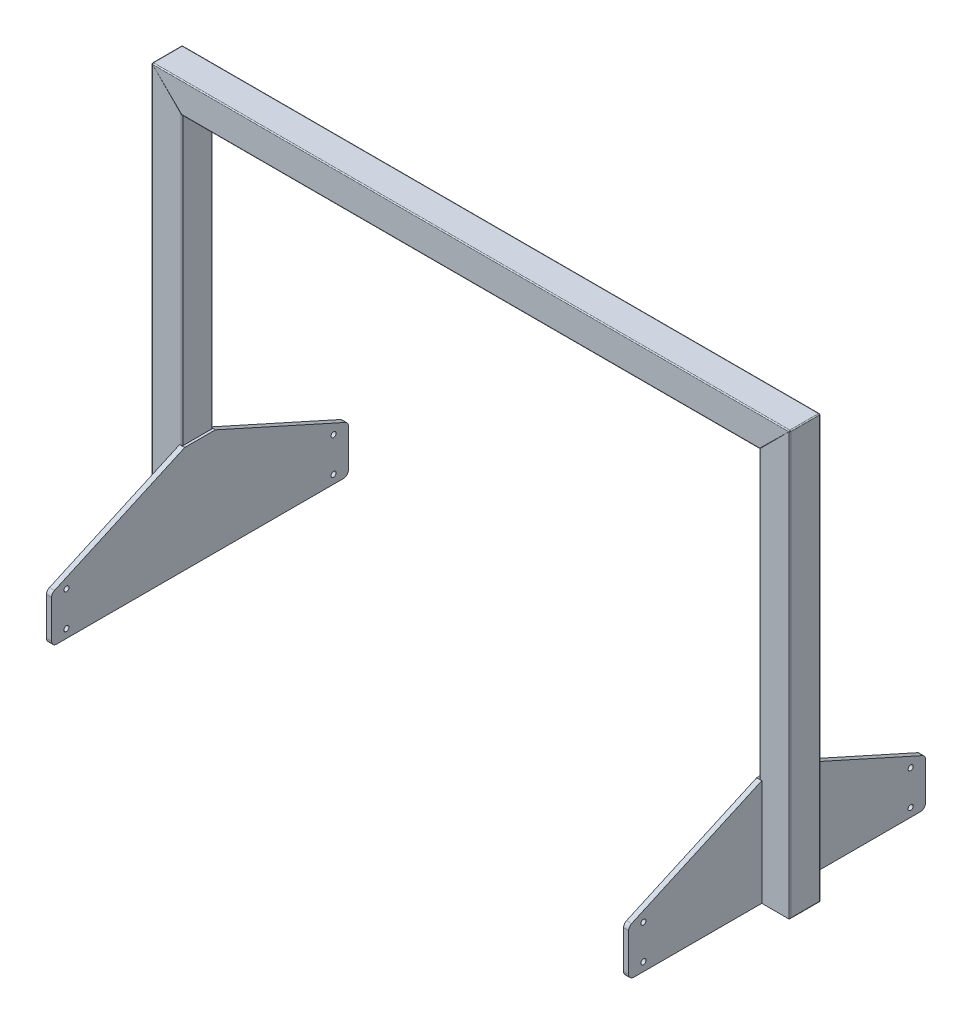
from build123d import *

# Parameters (mm, degrees)
BOSS_EXTRUDE1_DEPTH = 15
SKETCH2_R           = 2.5
BOSS_EXTRUDE2_DEPTH = 2.5
FILLET1_R           = 1


with BuildPart() as part:
    # Sketch1 → Boss-Extrude1 (new, symmetric)
    with BuildSketch(Plane.XY):
        Polygon((-283.115153194, -200), (-283.115153194, 184.822832525), (-312.771891152, 214.573189293), (-282.723872007, 185), (282.728718813, 185), (312.776737958, 214.573189293), (283.12, 184.822832525), (283.12, -200), (313.12, -200), (313.12, 215), (-313.115153194, 215), (-313.115153194, -200), align=None)
    extrude(amount=BOSS_EXTRUDE1_DEPTH, both=True)

    # Sketch2 → Boss-Extrude2 (add, symmetric)
    with BuildSketch(Plane.ZY.offset(-283.12)):
        with BuildLine():
            Line((-15, -95.731232334), (-142.725217813, -153.297064452))
            ThreePointArc((-142.725217813, -153.297064452), (-144.870286213, -155.141843308), (-145.67073896, -157.855476088))
            Line((-145.67073896, -157.855476088), (-145.67073896, -195))
            ThreePointArc((-145.67073896, -195), (-144.206272866, -198.535533906), (-140.67073896, -200))
            Line((-140.67073896, -200), (140.67073896, -200))
            ThreePointArc((140.67073896, -200), (144.206272866, -198.535533906), (145.67073896, -195))
            Line((145.67073896, -195), (145.67073896, -157.855476088))
            ThreePointArc((145.67073896, -157.855476088), (144.870286213, -155.141843308), (142.725217813, -153.297064452))
            Line((142.725217813, -153.297064452), (15, -95.731232334))
            Line((15, -95.731232334), (-15, -95.731232334))
        make_face()
        with Locations(Location((-131.096268678, -157.855476088, 0), (0, 0, 270))):
            Circle(SKETCH2_R, mode=Mode.SUBTRACT)
        with Locations(Location((-131.096268678, -191.557763375, 0), (0, 0, 270))):
            Circle(SKETCH2_R, mode=Mode.SUBTRACT)
        with Locations(Location((131.096268678, -191.557763375, 0), (0, 0, 90))):
            Circle(SKETCH2_R, mode=Mode.SUBTRACT)
        with Locations(Location((131.096268678, -157.855476088, 0), (0, 0, 90))):
            Circle(SKETCH2_R, mode=Mode.SUBTRACT)
    boss_extrude2 = extrude(amount=BOSS_EXTRUDE2_DEPTH, both=True)

    # Mirror2: Boss-Extrude2 across plane
    add(boss_extrude2.mirror(Plane(origin=(0, 0, 0), x_dir=(0, 0, 1), z_dir=(1, 0, 0))))

    # Fillet1
    # the kernel refuses this fillet: 1 mm, written as the material it takes off along each edge
    with BuildSketch(Plane(origin=(-312.115153194, 214, -14), x_dir=(0, 0, -1), z_dir=(-1, 0, 0))) as fillet1_piece_1_section:
        Polygon((0, 0), (FILLET1_R * 1.02, 0), (FILLET1_R * 1.02, -FILLET1_R * 1.02), (0, -FILLET1_R * 1.02), align=None)
    fillet1_piece_1 = extrude(amount=FILLET1_R * 1.02, mode=Mode.PRIVATE)
    fillet1_piece_1 = fillet1_piece_1 - Plane(origin=(-312.115153194, 214, -14), x_dir=(0, -0.7071067811865475, 0.7071067811865475), z_dir=(-1, 0, 0)) * Sphere(FILLET1_R, mode=Mode.PRIVATE)
    add(fillet1_piece_1, mode=Mode.SUBTRACT)
    with BuildSketch(Plane(origin=(312.12, 214, -14), x_dir=(1, 0, 0), z_dir=(0, 1, 0))) as fillet1_piece_2_section:
        Polygon((0, 0), (FILLET1_R * 1.02, 0), (FILLET1_R * 1.02, FILLET1_R * 1.02), (0, FILLET1_R * 1.02), align=None)
    fillet1_piece_2 = extrude(amount=FILLET1_R * 1.02, mode=Mode.PRIVATE)
    fillet1_piece_2 = fillet1_piece_2 - Plane(origin=(312.12, 214, -14), x_dir=(-0.7071067811865475, 0, 0.7071067811865475), z_dir=(0, 1, 0)) * Sphere(FILLET1_R, mode=Mode.PRIVATE)
    add(fillet1_piece_2, mode=Mode.SUBTRACT)
    with BuildSketch(Plane(origin=(-312.115153194, 214, 14), x_dir=(0, 0, 1), z_dir=(-1, 0, 0))) as fillet1_piece_3_section:
        Polygon((0, 0), (FILLET1_R * 1.02, 0), (FILLET1_R * 1.02, FILLET1_R * 1.02), (0, FILLET1_R * 1.02), align=None)
    fillet1_piece_3 = extrude(amount=FILLET1_R * 1.02, mode=Mode.PRIVATE)
    fillet1_piece_3 = fillet1_piece_3 - Plane(origin=(-312.115153194, 214, 14), x_dir=(0, -0.7071067811865475, -0.7071067811865475), z_dir=(-1, 0, 0)) * Sphere(FILLET1_R, mode=Mode.PRIVATE)
    add(fillet1_piece_3, mode=Mode.SUBTRACT)
    with BuildSketch(Plane(origin=(312.12, 214, 14), x_dir=(1, 0, 0), z_dir=(0, 1, 0))) as fillet1_piece_4_section:
        Polygon((0, 0), (FILLET1_R * 1.02, 0), (FILLET1_R * 1.02, -FILLET1_R * 1.02), (0, -FILLET1_R * 1.02), align=None)
    fillet1_piece_4 = extrude(amount=FILLET1_R * 1.02, mode=Mode.PRIVATE)
    fillet1_piece_4 = fillet1_piece_4 - Plane(origin=(312.12, 214, 14), x_dir=(-0.7071067811865475, 0, -0.7071067811865475), z_dir=(0, 1, 0)) * Sphere(FILLET1_R, mode=Mode.PRIVATE)
    add(fillet1_piece_4, mode=Mode.SUBTRACT)
    with BuildSketch(Plane(origin=(-313.115153194, 214, -15), x_dir=(0, 0, 1), z_dir=(0, -1, 0)), Plane(origin=(313.12, -202.5, 15), x_dir=(-1, 0, 0), z_dir=(0, 1, 0))) as fillet1_piece_5:
        with BuildLine():
            CenterArc((FILLET1_R, -FILLET1_R), FILLET1_R, 90, 90)
            Line((0, -FILLET1_R), (0, 0))
            Line((0, 0), (FILLET1_R, 0))
        make_face()
    extrude(amount=416.5, mode=Mode.SUBTRACT)
    with BuildSketch(Plane(origin=(312.12, 215, -15), x_dir=(0, -1, 0), z_dir=(-1, 0, 0))) as fillet1_piece_6:
        with BuildLine():
            CenterArc((FILLET1_R, FILLET1_R), FILLET1_R, 180, 90)
            Line((0, FILLET1_R), (0, 0))
            Line((0, 0), (FILLET1_R, 0))
        make_face()
    extrude(amount=624.235153194, mode=Mode.SUBTRACT)
    with BuildSketch(Plane(origin=(313.12, -202.5, -15), x_dir=(-1, 0, 0), z_dir=(0, 1, 0)), Plane(origin=(-313.115153194, 214, 15), x_dir=(0, 0, -1), z_dir=(0, -1, 0))) as fillet1_piece_7:
        with BuildLine():
            CenterArc((FILLET1_R, FILLET1_R), FILLET1_R, 180, 90)
            Line((0, FILLET1_R), (0, 0))
            Line((0, 0), (FILLET1_R, 0))
        make_face()
    extrude(amount=416.5, mode=Mode.SUBTRACT)
    with BuildSketch(Plane(origin=(283.12, 187.322832525, -15), x_dir=(1, 0, 0), z_dir=(0, -1, 0))) as fillet1_piece_8_section:
        with BuildLine():
            CenterArc((FILLET1_R, FILLET1_R), FILLET1_R, 180, 90)
            Line((0, FILLET1_R), (0, 0))
            Line((0, 0), (FILLET1_R, 0))
        make_face()
    fillet1_piece_8 = extrude(amount=283.054064858, mode=Mode.PRIVATE)
    fillet1_piece_8 = split(fillet1_piece_8, bisect_by=Plane(origin=(212.904028108, 116.278704743, -14.776762441), z_dir=(0.7014530599300108, -0.712715654882664, 0)), keep=Keep.TOP, mode=Mode.PRIVATE)
    add(fillet1_piece_8, mode=Mode.SUBTRACT)
    with BuildSketch(Plane(origin=(-285.223872007, 185, -15), x_dir=(0, 1, 0), z_dir=(1, 0, 0))) as fillet1_piece_9_section:
        with BuildLine():
            CenterArc((FILLET1_R, FILLET1_R), FILLET1_R, 180, 90)
            Line((0, FILLET1_R), (0, 0))
            Line((0, 0), (FILLET1_R, 0))
        make_face()
    fillet1_piece_9 = extrude(amount=570.45259082, mode=Mode.PRIVATE)
    fillet1_piece_9 = split(fillet1_piece_9, bisect_by=Plane(origin=(139.225783569, 43.764750927, -14.776706333), z_dir=(-0.7014530599300108, 0.712715654882664, 0)), keep=Keep.TOP, mode=Mode.PRIVATE)
    fillet1_piece_9 = split(fillet1_piece_9, bisect_by=Plane(origin=(-142.20285466, 43.465709552, -14.776706333), z_dir=(0.7082202214843082, 0.7059915848512059, 0)), keep=Keep.TOP, mode=Mode.PRIVATE)
    add(fillet1_piece_9, mode=Mode.SUBTRACT)
    with BuildSketch(Plane(origin=(-313.115153194, -200, 17.5), x_dir=(1, 0, 0), z_dir=(0, 0, -1))) as fillet1_piece_10:
        with BuildLine():
            CenterArc((FILLET1_R, -FILLET1_R), FILLET1_R, 90, 90)
            Line((0, -FILLET1_R), (0, 0))
            Line((0, 0), (FILLET1_R, 0))
        make_face()
    extrude(amount=35, mode=Mode.SUBTRACT)
    with BuildSketch(Plane(origin=(-313.115153194, 215, 14), x_dir=(0, -1, 0), z_dir=(0, 0, -1))) as fillet1_piece_11:
        with BuildLine():
            CenterArc((FILLET1_R, -FILLET1_R), FILLET1_R, 90, 90)
            Line((0, -FILLET1_R), (0, 0))
            Line((0, 0), (FILLET1_R, 0))
        make_face()
    extrude(amount=28, mode=Mode.SUBTRACT)
    with BuildSketch(Plane(origin=(313.12, 215, -14), x_dir=(-1, 0, 0), z_dir=(0, 0, 1))) as fillet1_piece_12:
        with BuildLine():
            CenterArc((FILLET1_R, FILLET1_R), FILLET1_R, 180, 90)
            Line((0, FILLET1_R), (0, 0))
            Line((0, 0), (FILLET1_R, 0))
        make_face()
    extrude(amount=28, mode=Mode.SUBTRACT)
    with BuildSketch(Plane(origin=(-285.223872007, 185, 15), x_dir=(0, 1, 0), z_dir=(1, 0, 0))) as fillet1_piece_13_section:
        with BuildLine():
            CenterArc((FILLET1_R, -FILLET1_R), FILLET1_R, 90, 90)
            Line((0, -FILLET1_R), (0, 0))
            Line((0, 0), (FILLET1_R, 0))
        make_face()
    fillet1_piece_13 = extrude(amount=570.45259082, mode=Mode.PRIVATE)
    fillet1_piece_13 = split(fillet1_piece_13, bisect_by=Plane(origin=(139.225783569, 43.764750927, 14.776706333), z_dir=(-0.7014530599300108, 0.712715654882664, 0)), keep=Keep.TOP, mode=Mode.PRIVATE)
    fillet1_piece_13 = split(fillet1_piece_13, bisect_by=Plane(origin=(-142.20285466, 43.465709552, 14.776706333), z_dir=(0.7082202214843082, 0.7059915848512059, 0)), keep=Keep.TOP, mode=Mode.PRIVATE)
    add(fillet1_piece_13, mode=Mode.SUBTRACT)
    with BuildSketch(Plane(origin=(313.12, -200, -17.5), x_dir=(0, 1, 0), z_dir=(0, 0, 1))) as fillet1_piece_14:
        with BuildLine():
            CenterArc((FILLET1_R, FILLET1_R), FILLET1_R, 180, 90)
            Line((0, FILLET1_R), (0, 0))
            Line((0, 0), (FILLET1_R, 0))
        make_face()
    extrude(amount=35, mode=Mode.SUBTRACT)
    with BuildSketch(Plane(origin=(282.728718813, 185, -16.023890127), x_dir=(0.7127156548826233, 0.701453059930052, 0), z_dir=(0, 0, 1)), Plane(origin=(-282.723872007, 185, -16.023890127), x_dir=(1, 0, 0), z_dir=(0, 0, 1))) as fillet1_piece_15:
        with BuildLine():
            CenterArc((FILLET1_R * 0.409556050901, FILLET1_R), FILLET1_R, 225.456300233, 44.543699767)
            Line((-FILLET1_R * 0.291897009029, FILLET1_R * 0.287284345117), (0, 0))
            Line((0, 0), (FILLET1_R * 0.409556050901, 0))
        make_face()
    extrude(amount=32.047780255, mode=Mode.SUBTRACT)
    with BuildSketch(Plane(origin=(283.12, 187.322832525, 15), x_dir=(1, 0, 0), z_dir=(0, -1, 0))) as fillet1_piece_16_section:
        with BuildLine():
            CenterArc((FILLET1_R, -FILLET1_R), FILLET1_R, 90, 90)
            Line((0, -FILLET1_R), (0, 0))
            Line((0, 0), (FILLET1_R, 0))
        make_face()
    fillet1_piece_16 = extrude(amount=283.054064858, mode=Mode.PRIVATE)
    fillet1_piece_16 = split(fillet1_piece_16, bisect_by=Plane(origin=(212.904028108, 116.278704743, 14.776762441), z_dir=(0.7014530599300108, -0.712715654882664, 0)), keep=Keep.TOP, mode=Mode.PRIVATE)
    add(fillet1_piece_16, mode=Mode.SUBTRACT)
    with BuildSketch(Plane(origin=(312.12, 215, 15), x_dir=(0, -1, 0), z_dir=(-1, 0, 0))) as fillet1_piece_17:
        with BuildLine():
            CenterArc((FILLET1_R, -FILLET1_R), FILLET1_R, 90, 90)
            Line((0, -FILLET1_R), (0, 0))
            Line((0, 0), (FILLET1_R, 0))
        make_face()
    extrude(amount=624.235153194, mode=Mode.SUBTRACT)
    with BuildSketch(Plane(origin=(-283.115153194, -95.731232334, -15), x_dir=(-1, 0, 0), z_dir=(0, 1, 0))) as fillet1_piece_18_section:
        with BuildLine():
            CenterArc((FILLET1_R, FILLET1_R), FILLET1_R, 180, 90)
            Line((0, FILLET1_R), (0, 0))
            Line((0, 0), (FILLET1_R, 0))
        make_face()
    fillet1_piece_18 = extrude(amount=283.054064858, mode=Mode.PRIVATE)
    fillet1_piece_18 = split(fillet1_piece_18, bisect_by=Plane(origin=(-142.946899789, 44.212103442, -14.61922956), z_dir=(-0.7082202214843082, -0.7059915848512059, 0)), keep=Keep.TOP, mode=Mode.PRIVATE)
    add(fillet1_piece_18, mode=Mode.SUBTRACT)
    with BuildSketch(Plane(origin=(-283.115153194, -95.731232334, 15), x_dir=(-1, 0, 0), z_dir=(0, 1, 0))) as fillet1_piece_19_section:
        with BuildLine():
            CenterArc((FILLET1_R, -FILLET1_R), FILLET1_R, 90, 90)
            Line((0, -FILLET1_R), (0, 0))
            Line((0, 0), (FILLET1_R, 0))
        make_face()
    fillet1_piece_19 = extrude(amount=283.054064858, mode=Mode.PRIVATE)
    fillet1_piece_19 = split(fillet1_piece_19, bisect_by=Plane(origin=(-142.946899789, 44.212103442, 14.61922956), z_dir=(-0.7082202214843082, -0.7059915848512059, 0)), keep=Keep.TOP, mode=Mode.PRIVATE)
    add(fillet1_piece_19, mode=Mode.SUBTRACT)


solid = part.part
